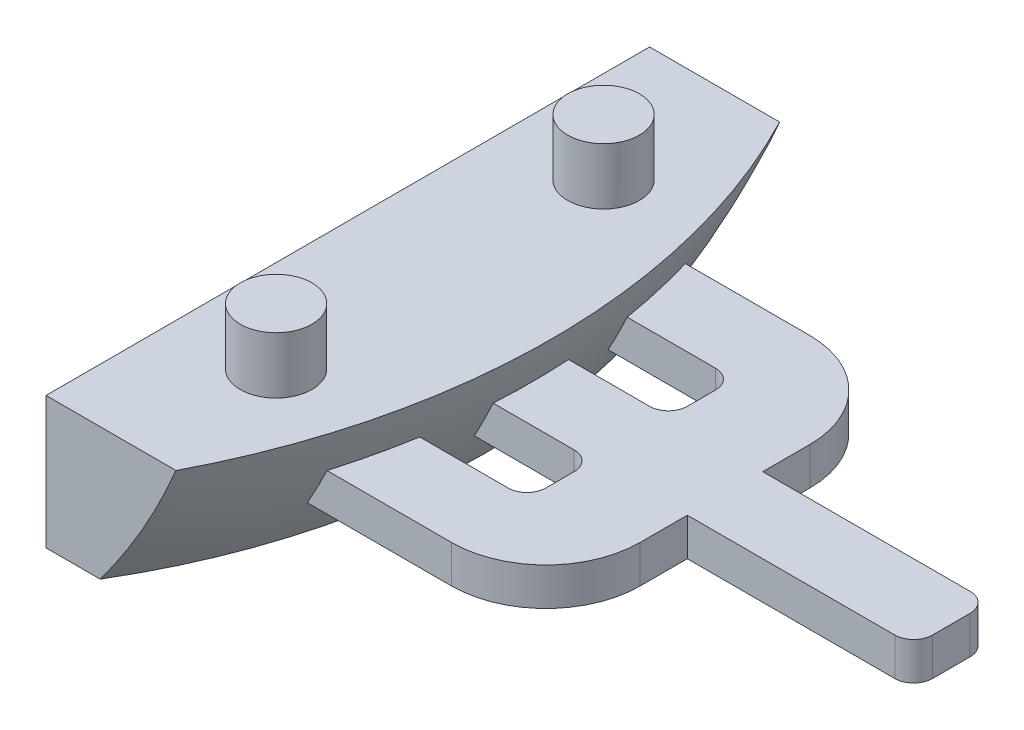
from build123d import *
from build123d.topology import SkipClean

# Parameters (mm, degrees)
CUT_EXTRUDE_3_DEPTH       = 80
CUT_EXTRUDE_START         = -57
CUT_EXTRUDE_4_DEPTH       = 57
CUT_EXTRUDE_4_2_OUTLINE_W = 14.17
CUT_EXTRUDE_4_2_OUTLINE_H = 32
CUT_EXTRUDE_4_2_DEPTH     = 50
SKETCH_7_R                = 1.9
EXTRUDE_2_DEPTH           = 3
SKETCH_8_W                = 4
SKETCH_8_H                = 2
EXTRUDE_3_DEPTH           = 15
SKETCH_9_W                = 19
SKETCH_9_H                = 2
EXTRUDE_4_DEPTH           = 5
SKETCH_8_2_W              = 4
SKETCH_8_2_H              = 2
EXTRUDE_5_DEPTH           = 32
FILLET_1_R                = 5
FILLET_2_R                = 1
FILLET_3_R                = 1


# Read off the part's stored shape, not the designer's step: 컷-돌출4
with BuildPart() as part:
    # 스케치4 → 회전1 (revolve)
    with SkipClean():  # the faces are left unmerged after this step: merging them gives an invalid solid
        with BuildSketch(Plane.XY):
            with BuildLine():
                ThreePointArc((37, 0), (26.162950904, 26.162950904), (0, 37))
                Line((0, 37), (0, -37))
                ThreePointArc((0, -37), (26.162950904, -26.162950904), (37, 0))
            make_face()
            with BuildLine():
                Line((0, -37), (0, 37))
                ThreePointArc((0, 37), (-37, 0), (0, -37))
            make_face()
        revolve(axis=Axis((0, 48.172126022, 0), (0, -1, 0)))

    # 스케치5 → 컷-돌출3 (cut, symmetric)
    with SkipClean():  # the faces are left unmerged after this step: merging them gives an invalid solid
        with BuildSketch(Plane.XY):
            Polygon((-37.71852549, -20), (40.89907451, -20), (49.098598746, -47.851019931), (-38.951742745, -43.163184314), align=None)
        extrude(amount=CUT_EXTRUDE_3_DEPTH, both=True, mode=Mode.SUBTRACT)

    # 컷-돌출4 outline → 컷-돌출4 (cut)
    with BuildSketch(Plane.XZ.offset(20).offset(CUT_EXTRUDE_START)):
        Polygon((23.83, -16), (23.83, 16), (38, 16), (38, 38), (-38, 38), (-38, -38), (38, -38), (38, -16), align=None)
    extrude(amount=CUT_EXTRUDE_4_DEPTH, mode=Mode.SUBTRACT)

    # Cut-Extrude 4 2 outline → Cut-Extrude 4 2 (cut)
    with BuildSketch(Plane.XZ.offset(20).offset(CUT_EXTRUDE_START)):
        with Locations((30.915, 0)):
            Rectangle(CUT_EXTRUDE_4_2_OUTLINE_W, CUT_EXTRUDE_4_2_OUTLINE_H)
    extrude(amount=CUT_EXTRUDE_4_2_DEPTH, mode=Mode.SUBTRACT)

    # 스케치7 → 보스-돌출2 (add)
    with BuildSketch(Plane(origin=(0, -13, 0), x_dir=(1, 0, 0), z_dir=(0, 1, 0))):
        with Locations(Location((28.71, 8.68, 0), (0, 0, 90))):
            Circle(SKETCH_7_R)
        with Locations(Location((28.71, -8.68, 0), (0, 0, 90))):
            Circle(SKETCH_7_R)
    extrude(amount=EXTRUDE_2_DEPTH)

    # 스케치8 → 보스-돌출3 (add)
    with BuildSketch(Plane.ZY.offset(-23.83)):
        with Locations((-7.5, -16.5)):
            Rectangle(SKETCH_8_W, SKETCH_8_H)
        with Locations((0, -16.5)):
            Rectangle(SKETCH_8_W, SKETCH_8_H)
        with Locations((7.5, -16.5)):
            Rectangle(SKETCH_8_W, SKETCH_8_H)
    extrude(amount=-EXTRUDE_3_DEPTH)

    # 스케치9 → 보스-돌출4 (add)
    with BuildSketch(Plane(origin=(38.83, 0, 0), x_dir=(0, 0, -1), z_dir=(1, 0, 0))):
        with Locations((0, -16.5)):
            Rectangle(SKETCH_9_W, SKETCH_9_H)
    extrude(amount=EXTRUDE_4_DEPTH)

    # 스케치8<2> → 보스-돌출5 (add)
    with BuildSketch(Plane.ZY.offset(-23.83)):
        with Locations((0, -16.5)):
            Rectangle(SKETCH_8_2_W, SKETCH_8_2_H)
    extrude(amount=-EXTRUDE_5_DEPTH)

    # 필렛1
    fillet_1_edges = [part.edges().sort_by_distance(p)[0] for p in [
        (43.83, -16.5, 9.5),
        (43.83, -16.5, -9.5),
    ]]
    fillet(fillet_1_edges, radius=FILLET_1_R)

    # 필렛2
    fillet_2_edges = [part.edges().sort_by_distance(p)[0] for p in [
        (38.83, -16.5, 2),
        (38.83, -16.5, -2),
        (38.83, -16.5, 5.5),
        (38.83, -16.5, -5.5),
    ]]
    fillet(fillet_2_edges, radius=FILLET_2_R)

    # 필렛3
    fillet_3_edges = [part.edges().sort_by_distance(p)[0] for p in [
        (55.83, -16.5, 2),
        (55.83, -16.5, -2),
    ]]
    fillet(fillet_3_edges, radius=FILLET_3_R)


solid = part.part
